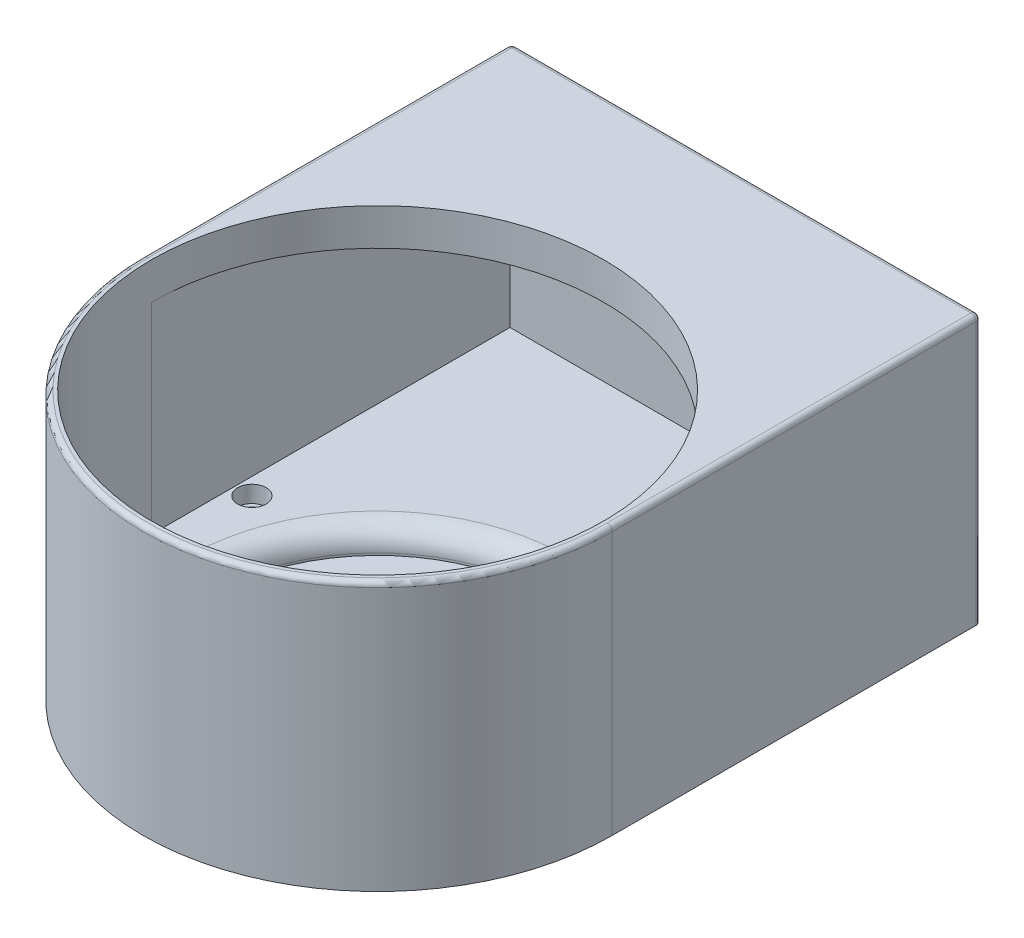
from build123d import *

# Parameters (mm, degrees)
CUT_EXTRUDE1_START                       = -160
CUT_EXTRUDE1_DEPTH                       = 138
CUT_EXTRUDE1_START_2                     = -22
CUT_EXTRUDE1_2_OUTLINE_R                 = 135
CUT_EXTRUDE1_2_DEPTH                     = 22
CUT_EXTRUDE2_START                       = -120
CUT_EXTRUDE2_DEPTH                       = 120
SKETCH3_W                                = 270
SKETCH3_H                                = 120
CUT_EXTRUDE3_DEPTH                       = 79
CUT_EXTRUDE4_DEPTH                       = 3
BOSS_EXTRUDE1_DEPTH                      = 3
CUT_EXTRUDE5_DEPTH                       = 3
BOSS_EXTRUDE2_DEPTH                      = 3
CUT_EXTRUDE6_DEPTH                       = 3
BOSS_EXTRUDE3_DEPTH                      = 3
CUT_EXTRUDE7_DEPTH                       = 3
CUT_EXTRUDE8_DEPTH                       = 2
CUT_EXTRUDE9_DEPTH                       = 3
CUT_EXTRUDE10_DEPTH                      = 2
HOLE1_D                                  = 200
HOLE1_DEPTH                              = 14
SKETCH16_W                               = 0.55
SKETCH16_H                               = 5
SKETCH17_W                               = 0.55
SKETCH17_H                               = 5
SKETCH18_W                               = 0.55
SKETCH18_H                               = 5
SKETCH19_W                               = 0.55
SKETCH19_H                               = 5
SKETCH20_W                               = 0.55
SKETCH20_H                               = 5
SKETCH21_W                               = 0.55
SKETCH21_H                               = 5
SKETCH22_W                               = 0.55
SKETCH22_H                               = 5
SKETCH23_W                               = 0.55
SKETCH23_H                               = 5
SKETCH24_W                               = 0.55
SKETCH24_H                               = 5
SKETCH25_W                               = 3
SKETCH25_H                               = 5
SKETCH26_W                               = 3
SKETCH26_H                               = 5
SKETCH27_W                               = 3
SKETCH27_H                               = 5
M3_CLEARANCE_HOLE1_D                     = 3.56
M3_CLEARANCE_HOLE1_DEPTH                 = 3
HOLE2_D                                  = 1.14
HOLE2_DEPTH                              = 3
CBORE_FOR_M10_HEX_HEAD_BOLT1_D           = 12
CBORE_FOR_M10_HEX_HEAD_BOLT1_DEPTH       = 18
CBORE_FOR_M10_HEX_HEAD_BOLT1_CBORE_D     = 17
CBORE_FOR_M10_HEX_HEAD_BOLT1_CBORE_DEPTH = 10
FILLET1_R                                = 0.5
FILLET2_R                                = 2.2
FILLET3_R                                = 3
FILLET4_R                                = 3.2
FILLET5_R                                = 12.7


with BuildPart() as part:
    # Cut-Extrude1: read off the stored shape, not the designer's step
    # Cut-Extrude1 outline → Cut-Extrude1 (new body)
    with BuildSketch(Plane(origin=(0, 160, 0), x_dir=(-1, 0, 0), z_dir=(0, 1, 0)).offset(CUT_EXTRUDE1_START)):
        with BuildLine():
            ThreePointArc((140, 0), (0, 140), (-140, 0))
            Line((-140, 0), (-140, -220))
            Line((-140, -220), (140, -220))
            Line((140, -220), (140, 0))
        make_face()
    extrude(amount=CUT_EXTRUDE1_DEPTH)

    # Cut-Extrude1 2 outline → Cut-Extrude1 2 (add)
    with BuildSketch(Plane(origin=(0, 160, 0), x_dir=(-1, 0, 0), z_dir=(0, 1, 0)).offset(CUT_EXTRUDE1_START_2)):
        with BuildLine():
            ThreePointArc((140, 0), (0, 140), (-140, 0))
            Line((-140, 0), (-140, -220))
            Line((-140, -220), (140, -220))
            Line((140, -220), (140, 0))
        make_face()
        Circle(CUT_EXTRUDE1_2_OUTLINE_R, mode=Mode.SUBTRACT)
    extrude(amount=CUT_EXTRUDE1_2_DEPTH)

    # Sketch2 → Cut-Extrude2 (cut)
    with BuildSketch(Plane(origin=(0, 138, 0), x_dir=(-1, 0, 0), z_dir=(0, 1, 0)).offset(CUT_EXTRUDE2_START)):
        with BuildLine():
            Line((-135, 0), (-135, -135))
            Line((-135, -135), (135, -135))
            Line((135, -135), (135, 0))
            ThreePointArc((135, 0), (0, 135), (-135, 0))
        make_face()
    extrude(amount=CUT_EXTRUDE2_DEPTH, mode=Mode.SUBTRACT)

    # Sketch3 → Cut-Extrude3 (cut)
    with BuildSketch(Plane.XY.offset(-135)):
        with Locations((0, 78)):
            Rectangle(SKETCH3_W, SKETCH3_H)
    extrude(amount=-CUT_EXTRUDE3_DEPTH, mode=Mode.SUBTRACT)

    # Sketch4 → Cut-Extrude4 (cut)
    with BuildSketch(Plane(origin=(0, 0, -220), x_dir=(-1, 0, 0), z_dir=(0, 0, -1))):
        Polygon((-86.002312272, 63), (-83.886388504, 75), (-106.113611496, 75), (-103.997687728, 63), align=None)
    extrude(amount=-CUT_EXTRUDE4_DEPTH, mode=Mode.SUBTRACT)

    # Sketch5 → Boss-Extrude1 (add)
    with BuildSketch(Plane(origin=(0, 0, -217), x_dir=(-1, 0, 0), z_dir=(0, 0, -1))):
        Polygon((-86.841411903, 64), (-103.158588097, 64), (-104.921857904, 74), (-85.078142096, 74), align=None)
    extrude(amount=BOSS_EXTRUDE1_DEPTH)

    # Sketch6 → Cut-Extrude5 (cut)
    with BuildSketch(Plane(origin=(0, 0, -220), x_dir=(-1, 0, 0), z_dir=(0, 0, -1))):
        Polygon((-75.002312272, 23), (-72.886388504, 35), (-117.113611496, 35), (-114.997687728, 23), align=None)
    extrude(amount=-CUT_EXTRUDE5_DEPTH, mode=Mode.SUBTRACT)

    # Sketch7 → Boss-Extrude2 (add)
    with BuildSketch(Plane(origin=(0, 0, -217), x_dir=(-1, 0, 0), z_dir=(0, 0, -1))):
        Polygon((-75.841411903, 24), (-114.158588097, 24), (-115.921857904, 34), (-74.078142096, 34), align=None)
    extrude(amount=BOSS_EXTRUDE2_DEPTH)

    # Sketch8 → Cut-Extrude6 (cut)
    with BuildSketch(Plane(origin=(0, 0, -220), x_dir=(-1, 0, 0), z_dir=(0, 0, -1))):
        Polygon((-75.002312272, 43), (-72.886388504, 55), (-117.113611496, 55), (-114.997687728, 43), align=None)
    extrude(amount=-CUT_EXTRUDE6_DEPTH, mode=Mode.SUBTRACT)

    # Sketch9 → Boss-Extrude3 (add)
    with BuildSketch(Plane(origin=(0, 0, -217), x_dir=(-1, 0, 0), z_dir=(0, 0, -1))):
        Polygon((-75.841411903, 44), (-114.158588097, 44), (-115.921857904, 54), (-74.078142096, 54), align=None)
    extrude(amount=BOSS_EXTRUDE3_DEPTH)

    # Sketch10 → Cut-Extrude7 (cut)
    with BuildSketch(Plane(origin=(0, 0, -220), x_dir=(-1, 0, 0), z_dir=(0, 0, -1))):
        Polygon((123.497687728, 23), (125.613611496, 35), (94.386388504, 35), (96.502312272, 23), align=None)
    extrude(amount=-CUT_EXTRUDE7_DEPTH, mode=Mode.SUBTRACT)

    # Sketch11 → Cut-Extrude8 (cut)
    with BuildSketch(Plane(origin=(0, 0, -217), x_dir=(-1, 0, 0), z_dir=(0, 0, -1))):
        Polygon((97.341411903, 24), (122.658588097, 24), (124.421857904, 34), (95.578142096, 34), align=None)
    extrude(amount=-CUT_EXTRUDE8_DEPTH, mode=Mode.SUBTRACT)

    # Sketch12 → Cut-Extrude9 (cut)
    with BuildSketch(Plane(origin=(0, 0, -220), x_dir=(-1, 0, 0), z_dir=(0, 0, -1))):
        Polygon((118.997687728, 43), (121.113611496, 55), (98.886388504, 55), (101.002312272, 43), align=None)
    extrude(amount=-CUT_EXTRUDE9_DEPTH, mode=Mode.SUBTRACT)

    # Sketch13 → Cut-Extrude10 (cut)
    with BuildSketch(Plane(origin=(0, 0, -217), x_dir=(-1, 0, 0), z_dir=(0, 0, -1))):
        Polygon((101.841411903, 44), (118.158588097, 44), (119.921857904, 54), (100.078142096, 54), align=None)
    extrude(amount=-CUT_EXTRUDE10_DEPTH, mode=Mode.SUBTRACT)

    # Hole1
    with Locations(Plane(origin=(0, 18, 0), x_dir=(1, 0, 0), z_dir=(0, 1, 0))):
        with Locations((0, 0)):
            Hole(HOLE1_D / 2, depth=HOLE1_DEPTH)

    # Sketch16 → Revolve1 (revolve)
    with BuildSketch(Plane.XZ.offset(-50.4224), mode=Mode.PRIVATE) as revolve1_sk:
        with Locations((-115.2622, -217.5)):
            Rectangle(SKETCH16_W, SKETCH16_H)
    revolve(revolve1_sk.sketch.rotate(Axis((-115.5372, 50.4224, -215), (0, 0, -1)), 180), axis=Axis((-115.5372, 50.4224, -215), (0, 0, -1)))

    # Sketch17 → Revolve2 (revolve)
    with BuildSketch(Plane.XZ.offset(-50.4224), mode=Mode.PRIVATE) as revolve2_sk:
        with Locations((-112.4936, -217.5)):
            Rectangle(SKETCH17_W, SKETCH17_H)
    revolve(revolve2_sk.sketch.rotate(Axis((-112.7686, 50.4224, -215), (0, 0, -1)), 180), axis=Axis((-112.7686, 50.4224, -215), (0, 0, -1)))

    # Sketch18 → Revolve3 (revolve)
    with BuildSketch(Plane.XZ.offset(-47.5776), mode=Mode.PRIVATE) as revolve3_sk:
        with Locations((-113.8779, -217.5)):
            Rectangle(SKETCH18_W, SKETCH18_H)
    revolve(revolve3_sk.sketch.rotate(Axis((-114.1529, 47.5776, -215), (0, 0, -1)), 180), axis=Axis((-114.1529, 47.5776, -215), (0, 0, -1)))

    # Sketch19 → Revolve4 (revolve)
    with BuildSketch(Plane.XZ.offset(-47.5776), mode=Mode.PRIVATE) as revolve4_sk:
        with Locations((-105.5721, -217.5)):
            Rectangle(SKETCH19_W, SKETCH19_H)
    revolve(revolve4_sk.sketch.rotate(Axis((-105.8471, 47.5776, -215), (0, 0, -1)), 180), axis=Axis((-105.8471, 47.5776, -215), (0, 0, -1)))

    # Sketch20 → Revolve5 (revolve)
    with BuildSketch(Plane.XZ.offset(-50.4224), mode=Mode.PRIVATE) as revolve5_sk:
        with Locations((-104.1878, -217.5)):
            Rectangle(SKETCH20_W, SKETCH20_H)
    revolve(revolve5_sk.sketch.rotate(Axis((-104.4628, 50.4224, -215), (0, 0, -1)), 180), axis=Axis((-104.4628, 50.4224, -215), (0, 0, -1)))

    # Sketch21 → Revolve6 (revolve)
    with BuildSketch(Plane.XZ.offset(-47.5776), mode=Mode.PRIVATE) as revolve6_sk:
        with Locations((-108.3407, -217.5)):
            Rectangle(SKETCH21_W, SKETCH21_H)
    revolve(revolve6_sk.sketch.rotate(Axis((-108.6157, 47.5776, -215), (0, 0, -1)), 180), axis=Axis((-108.6157, 47.5776, -215), (0, 0, -1)))

    # Sketch22 → Revolve7 (revolve)
    with BuildSketch(Plane.XZ.offset(-50.4224), mode=Mode.PRIVATE) as revolve7_sk:
        with Locations((-106.9564, -217.5)):
            Rectangle(SKETCH22_W, SKETCH22_H)
    revolve(revolve7_sk.sketch.rotate(Axis((-107.2314, 50.4224, -215), (0, 0, -1)), 180), axis=Axis((-107.2314, 50.4224, -215), (0, 0, -1)))

    # Sketch23 → Revolve8 (revolve)
    with BuildSketch(Plane.XZ.offset(-47.5776), mode=Mode.PRIVATE) as revolve8_sk:
        with Locations((-111.1093, -217.5)):
            Rectangle(SKETCH23_W, SKETCH23_H)
    revolve(revolve8_sk.sketch.rotate(Axis((-111.3843, 47.5776, -215), (0, 0, -1)), 180), axis=Axis((-111.3843, 47.5776, -215), (0, 0, -1)))

    # Sketch24 → Revolve9 (revolve)
    with BuildSketch(Plane.XZ.offset(-50.4224), mode=Mode.PRIVATE) as revolve9_sk:
        with Locations((-109.725, -217.5)):
            Rectangle(SKETCH24_W, SKETCH24_H)
    revolve(revolve9_sk.sketch.rotate(Axis((-110, 50.4224, -215), (0, 0, -1)), 180), axis=Axis((-110, 50.4224, -215), (0, 0, -1)))

    # Sketch25 → Revolve10 (revolve)
    with BuildSketch(Plane.XZ.offset(-29), mode=Mode.PRIVATE) as revolve10_sk:
        with Locations((-116.7701115, -217.5)):
            Rectangle(SKETCH25_W, SKETCH25_H)
    revolve(revolve10_sk.sketch.rotate(Axis((-118.2701115, 29, -215), (0, 0, -1)), 180), axis=Axis((-118.2701115, 29, -215), (0, 0, -1)))

    # Sketch26 → Revolve11 (revolve)
    with BuildSketch(Plane.XZ.offset(-29), mode=Mode.PRIVATE) as revolve11_sk:
        with Locations((-100.2298885, -217.5)):
            Rectangle(SKETCH26_W, SKETCH26_H)
    revolve(revolve11_sk.sketch.rotate(Axis((-101.7298885, 29, -215), (0, 0, -1)), 180), axis=Axis((-101.7298885, 29, -215), (0, 0, -1)))

    # Sketch27 → Revolve12 (revolve)
    with BuildSketch(Plane.XZ.offset(-29), mode=Mode.PRIVATE) as revolve12_sk:
        with Locations((-108.5, -217.5)):
            Rectangle(SKETCH27_W, SKETCH27_H)
    revolve(revolve12_sk.sketch.rotate(Axis((-110, 29, -215), (0, 0, -1)), 180), axis=Axis((-110, 29, -215), (0, 0, -1)))

    # M3 Clearance Hole1
    with Locations(Plane(origin=(0, 0, -220), x_dir=(-1, 0, 0), z_dir=(0, 0, -1))):
        with Locations((-95, 69), (-80.52, 29), (-109.48, 29), (-87.23, 29), (-80.52, 49), (-109.48, 49), (-87.23, 49)):
            Hole(M3_CLEARANCE_HOLE1_D / 2, depth=M3_CLEARANCE_HOLE1_DEPTH)

    # Hole2
    with Locations(Plane(origin=(0, 0, -220), x_dir=(-1, 0, 0), z_dir=(0, 0, -1))):
        with Locations((-90.885, 67.58), (-99.115, 67.58), (-100.49, 70.42), (-89.51, 70.42), (-96.4, 27.58), (-93.6, 27.58), (-103.28, 30.42), (-92.23, 30.42), (-96.4, 47.58), (-93.6, 47.58), (-97.77, 30.42), (-95, 30.42), (-104.68, 27.58), (-101.91, 27.58), (-99.14, 27.58), (-100.54, 30.42), (-103.28, 50.42), (-92.23, 50.42), (-97.77, 50.42), (-95, 50.42), (-104.68, 47.58), (-101.91, 47.58), (-99.14, 47.58), (-100.54, 50.42)):
            Hole(HOLE2_D / 2, depth=HOLE2_DEPTH)

    # CBORE for M10 Hex Head Bolt1
    with Locations(Plane(origin=(0, 18, 0), x_dir=(1, 0, 0), z_dir=(0, 1, 0))):
        with Locations((125, 50), (-125, 50), (75, -100), (-75, -100)):
            CounterBoreHole(CBORE_FOR_M10_HEX_HEAD_BOLT1_D / 2, CBORE_FOR_M10_HEX_HEAD_BOLT1_CBORE_D / 2, CBORE_FOR_M10_HEX_HEAD_BOLT1_CBORE_DEPTH, depth=CBORE_FOR_M10_HEX_HEAD_BOLT1_DEPTH)

    # Fillet1
    fillet1_edges = [part.edges().sort_by_distance(p)[0] for p in [
        (-115.2701115, 29, -220),
        (-98.7298885, 29, -220),
        (-107, 29, -220),
    ]]
    fillet(fillet1_edges, radius=FILLET1_R)

    # Fillet2
    fillet2_edges = [part.edges().sort_by_distance(p)[0] for p in [
        (86.841411903, 64, -218.5),
        (85.078142096, 74, -218.5),
        (104.921857904, 74, -218.5),
        (103.158588097, 64, -218.5),
        (75.841411903, 24, -218.5),
        (74.078142096, 34, -218.5),
        (115.921857904, 34, -218.5),
        (114.158588097, 24, -218.5),
        (75.841411903, 44, -218.5),
        (74.078142096, 54, -218.5),
        (115.921857904, 54, -218.5),
        (114.158588097, 44, -218.5),
        (-97.341411903, 24, -216),
        (-95.578142096, 34, -216),
        (-124.421857904, 34, -216),
        (-122.658588097, 24, -216),
        (-101.841411903, 44, -216),
        (-100.078142096, 54, -216),
        (-119.921857904, 54, -216),
        (-118.158588097, 44, -216),
    ]]
    fillet(fillet2_edges, radius=FILLET2_R)

    # Fillet3
    fillet3_edges = [part.edges().sort_by_distance(p)[0] for p in [
        (0, 160, 140),
        (140, 80, -220),
        (140, 160, -110),
        (0, 160, -220),
        (-140, 160, -110),
        (-140, 80, -220),
    ]]
    fillet(fillet3_edges, radius=FILLET3_R)

    # Fillet4
    fillet4_edges = [part.edges().sort_by_distance(p)[0] for p in [
        (86.002312272, 63, -218.5),
        (103.997687728, 63, -218.5),
        (106.113611496, 75, -218.5),
        (83.886388504, 75, -218.5),
        (75.002312272, 23, -218.5),
        (114.997687728, 23, -218.5),
        (117.113611496, 35, -218.5),
        (72.886388504, 35, -218.5),
        (75.002312272, 43, -218.5),
        (114.997687728, 43, -218.5),
        (117.113611496, 55, -218.5),
        (72.886388504, 55, -218.5),
        (-123.497687728, 23, -218.5),
        (-96.502312272, 23, -218.5),
        (-94.386388504, 35, -218.5),
        (-125.613611496, 35, -218.5),
        (-118.997687728, 43, -218.5),
        (-101.002312272, 43, -218.5),
        (-98.886388504, 55, -218.5),
        (-121.113611496, 55, -218.5),
    ]]
    fillet(fillet4_edges, radius=FILLET4_R)

    # Fillet5
    fillet5_edges = [part.edges().sort_by_distance(p)[0] for p in [
        (100, 18, 0),
    ]]
    fillet(fillet5_edges, radius=FILLET5_R)


solid = part.part
